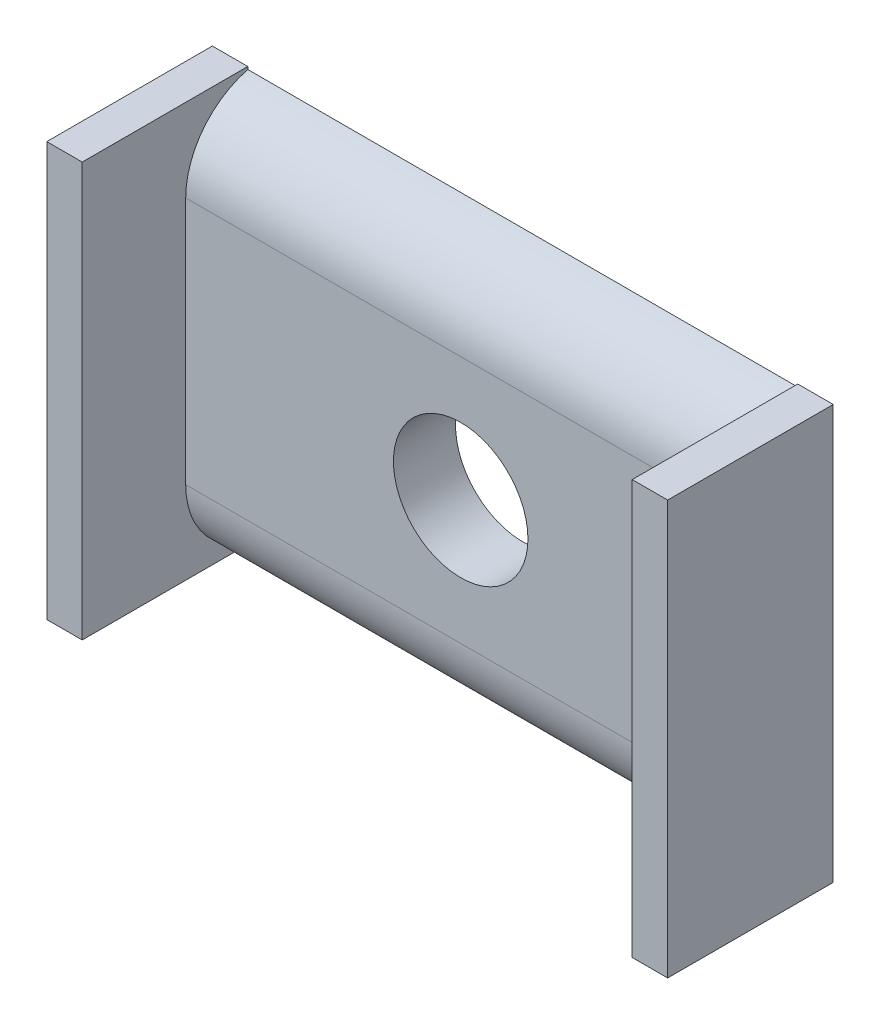
from build123d import *

# Parameters (mm, degrees)
CROQUIS1_W              = 30
CROQUIS1_H              = 20
CROQUIS1_R              = 3.25
SALIENTE_EXTRUIR1_DEPTH = 3
CROQUIS3_W              = 1.712937005
CROQUIS3_H              = 20
SALIENTE_EXTRUIR2_DEPTH = 5
REDONDEO1_R             = 4
REDONDEO2_R             = 4


with BuildPart() as part:
    # Croquis1 → Saliente-Extruir1 (new body)
    with BuildSketch(Plane.XY):
        Rectangle(CROQUIS1_W, CROQUIS1_H)
        Circle(CROQUIS1_R, mode=Mode.SUBTRACT)
    extrude(amount=SALIENTE_EXTRUIR1_DEPTH)

    # Croquis3 → Saliente-Extruir2 (add)
    with BuildSketch(Plane.XY.offset(3)):
        with Locations((-14.143531498, 0)):
            Rectangle(CROQUIS3_W, CROQUIS3_H)
        with Locations((14.143531498, 0)):
            Rectangle(CROQUIS3_W, CROQUIS3_H)
    extrude(amount=SALIENTE_EXTRUIR2_DEPTH)

    # Redondeo1
    # the kernel refuses this fillet: 4 mm, written as the material it takes off along each edge
    with BuildSketch(Plane(origin=(13.287062995, 10, 3), x_dir=(0, 0, -1), z_dir=(-1, 0, 0))) as redondeo1_piece_1:
        with BuildLine():
            CenterArc((REDONDEO1_R, REDONDEO1_R), REDONDEO1_R, 180, 90)
            Line((0, REDONDEO1_R), (0, 0))
            Line((0, 0), (REDONDEO1_R, 0))
        make_face()
    extrude(amount=26.574125991, mode=Mode.SUBTRACT)

    # Redondeo2
    # the kernel refuses this fillet: 4 mm, written as the material it takes off along each edge
    with BuildSketch(Plane(origin=(-13.287062995, -10, 3), x_dir=(0, 0, -1), z_dir=(1, 0, 0))) as redondeo2_piece_1:
        with BuildLine():
            CenterArc((REDONDEO2_R, REDONDEO2_R), REDONDEO2_R, 180, 90)
            Line((0, REDONDEO2_R), (0, 0))
            Line((0, 0), (REDONDEO2_R, 0))
        make_face()
    extrude(amount=26.574125991, mode=Mode.SUBTRACT)


solid = part.part
